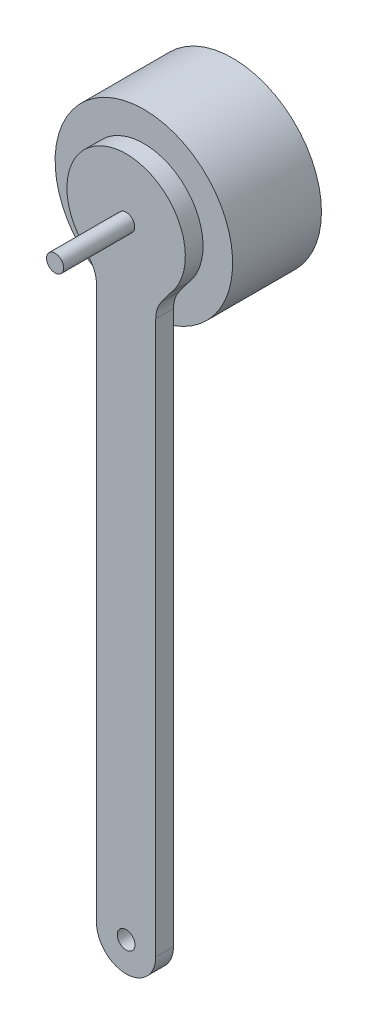
from build123d import *

# Parameters (mm, degrees)
SKETCH1_R           = 15
BOSS_EXTRUDE1_DEPTH = 15
SKETCH2_R           = 1.45
BOSS_EXTRUDE2_DEPTH = 15
BOSS_EXTRUDE3_DEPTH = 3
SKETCH5_R           = 1.5
CUT_EXTRUDE1_DEPTH  = 113.467773162
FILLET1_R           = 5


with BuildPart() as part:
    # Sketch1 → Boss-Extrude1 (new body)
    with BuildSketch(Plane.XY):
        Circle(SKETCH1_R)
    extrude(amount=BOSS_EXTRUDE1_DEPTH)

    # Sketch2 → Boss-Extrude2 (add)
    with BuildSketch(Plane.XY.offset(15)):
        Circle(SKETCH2_R)
    extrude(amount=BOSS_EXTRUDE2_DEPTH)

    # Sketch4 → Boss-Extrude3 (add)
    with BuildSketch(Plane.XY.offset(15)):
        with BuildLine():
            Line((5, -10), (7.465093605, -6.653749128))
            ThreePointArc((7.465093605, -6.653749128), (0, 10), (-7.465093605, -6.653749128))
            Line((-7.465093605, -6.653749128), (-5, -10))
            Line((-5, -10), (-5, -110))
            Line((-5, -110), (5, -110))
            Line((5, -110), (5, -10))
        make_face()
    extrude(amount=BOSS_EXTRUDE3_DEPTH)

    # Sketch5 → Cut-Extrude1 (cut, through all)
    with BuildSketch(Plane.XY.offset(18)):
        with Locations((0, -105)):
            Circle(SKETCH5_R)
    extrude(amount=-CUT_EXTRUDE1_DEPTH, mode=Mode.SUBTRACT)

    # Fillet1
    fillet1_edges = [part.edges().sort_by_distance(p)[0] for p in [
        (5, -10, 16.5),
        (-5, -10, 16.5),
        (-5, -110, 16.5),
        (5, -110, 16.5),
    ]]
    fillet(fillet1_edges, radius=FILLET1_R - 0.0001)  # a hair under: the kernel refuses the full size


solid = part.part
